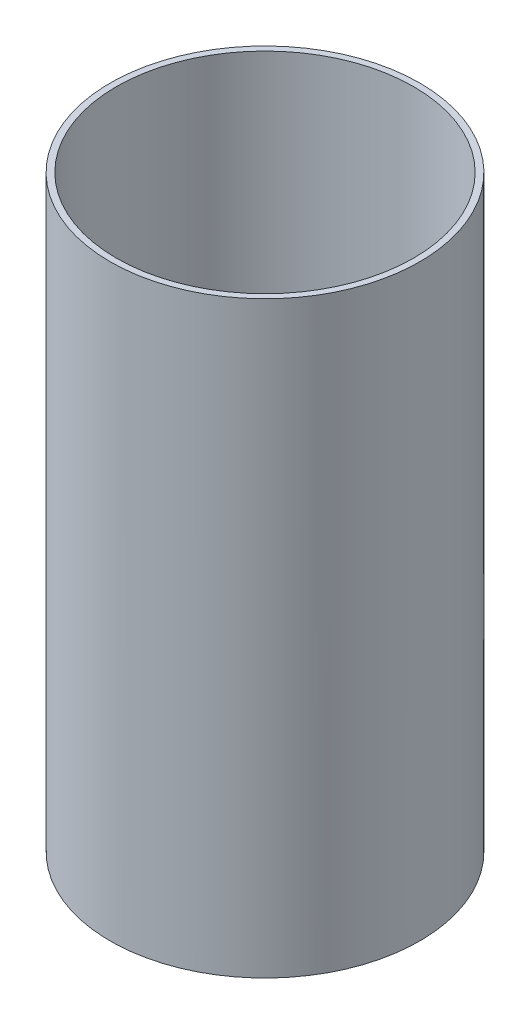
from build123d import *

# Parameters (mm, degrees)
SKETCH1_R           = 25
SKETCH1_R_2         = 24
BOSS_EXTRUDE1_DEPTH = 85
BOSS_EXTRUDE2_START = 10
SKETCH2_R           = 25
SKETCH2_R_2         = 24
BOSS_EXTRUDE2_DEPTH = 10


with BuildPart() as part:
    # Sketch1 → Boss-Extrude1 (new body)
    with BuildSketch(Plane(origin=(0, 0, 0), x_dir=(1, 0, 0), z_dir=(0, 1, 0))):
        Circle(SKETCH1_R)
        Circle(SKETCH1_R_2, mode=Mode.SUBTRACT)
    extrude(amount=BOSS_EXTRUDE1_DEPTH)

    # Sketch2 → Boss-Extrude2 (add)
    with BuildSketch(Plane.XZ.offset(BOSS_EXTRUDE2_START)):
        Circle(SKETCH2_R)
        Circle(SKETCH2_R_2, mode=Mode.SUBTRACT)
    extrude(amount=-BOSS_EXTRUDE2_DEPTH)


solid = part.part
